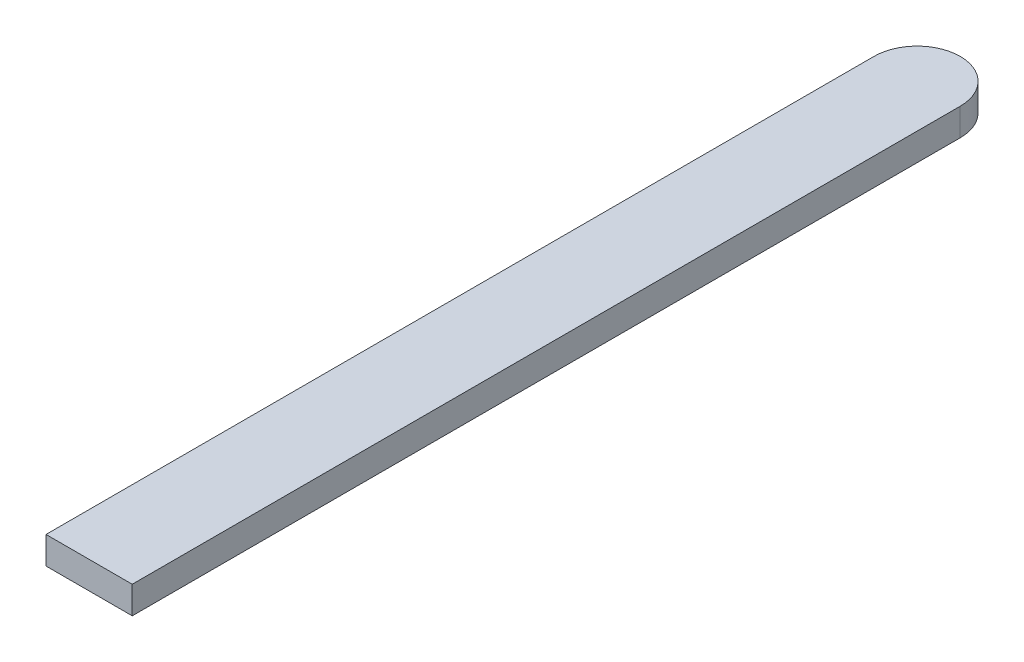
from build123d import *

# Parameters (mm, degrees)
BOSS_EXTRUDE1_DEPTH = 6.35


with BuildPart() as part:
    # Sketch1 → Boss-Extrude1 (new body)
    with BuildSketch(Plane(origin=(0, 0, 0), x_dir=(1, 0, 0), z_dir=(0, 1, 0))):
        with BuildLine():
            Line((-10, 96), (-10, -96))
            Line((-10, -96), (10, -96))
            Line((10, -96), (10, 96))
            ThreePointArc((10, 96), (0, 106), (-10, 96))
        make_face()
    extrude(amount=BOSS_EXTRUDE1_DEPTH)


solid = part.part
